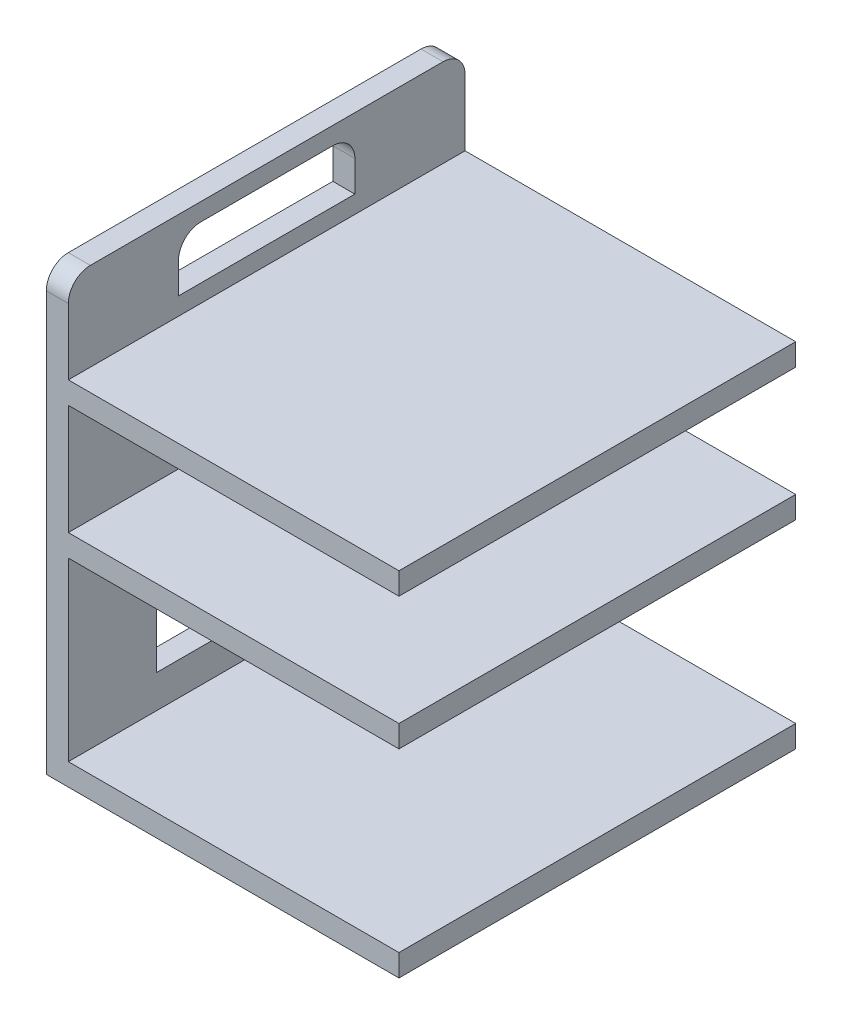
from build123d import *

# Parameters (mm, degrees)
BOSS_EXTRUDE1_DEPTH = 5
SKETCH2_W           = 90
SKETCH2_H           = 5
BOSS_EXTRUDE2_DEPTH = 75
CUT_EXTRUDE1_REACH  = 131.422
SKETCH4_W           = 40
SKETCH4_H           = 12
CUT_EXTRUDE2_REACH  = 131.422
SKETCH5_W           = 40
SKETCH5_H           = 12
CUT_EXTRUDE3_REACH  = 131.422
SKETCH7_W           = 50
SKETCH7_H           = 25
FILLET1_R           = 5
FILLET2_R           = 5


with BuildPart() as part:
    # Sketch1 → Boss-Extrude1 (new body)
    with BuildSketch(Plane(origin=(0, 0, 0), x_dir=(0, 0, -1), z_dir=(1, 0, 0))):
        Polygon((90, 45), (0, 45), (0, 25), (0, 20), (0, 16.441443772), (0, 4.747474747), (0, 0), (0, -5), (0, -10), (0, -50), (0, -55), (90, -55), (90, -10), (90, -5), (90, 16.441443772), (90, 25), align=None)
    extrude(amount=BOSS_EXTRUDE1_DEPTH)

    # Sketch2 → Boss-Extrude2 (add)
    with BuildSketch(Plane(origin=(5, 0, 0), x_dir=(0, 0, -1), z_dir=(1, 0, 0))):
        with Locations((45, 22.5)):
            Rectangle(SKETCH2_W, SKETCH2_H)
        with Locations((45, -7.5)):
            Rectangle(SKETCH2_W, SKETCH2_H)
        with Locations((45, -52.5)):
            Rectangle(SKETCH2_W, SKETCH2_H)
    extrude(amount=BOSS_EXTRUDE2_DEPTH)

    # Sketch4 → Cut-Extrude1 (cut, up to next)
    with BuildSketch(Plane(origin=(5, 0, 0), x_dir=(0, 0, -1), z_dir=(1, 0, 0)), mode=Mode.PRIVATE) as cut_extrude1_sk1:
        with Locations((45, 35)):
            Rectangle(SKETCH4_W, SKETCH4_H)
    cut_extrude1_tool1 = extrude(cut_extrude1_sk1.sketch, amount=-CUT_EXTRUDE1_REACH, mode=Mode.PRIVATE) & part.part
    add(cut_extrude1_tool1.solids().sort_by_distance((5, 35, -45))[0], mode=Mode.SUBTRACT)

    # Sketch5 → Cut-Extrude2 (cut, up to next)
    with BuildSketch(Plane(origin=(5, 0, 0), x_dir=(0, 0, -1), z_dir=(1, 0, 0)), mode=Mode.PRIVATE) as cut_extrude2_sk1:
        with Locations((45, 7.5)):
            Rectangle(SKETCH5_W, SKETCH5_H)
    cut_extrude2_tool1 = extrude(cut_extrude2_sk1.sketch, amount=-CUT_EXTRUDE2_REACH, mode=Mode.PRIVATE) & part.part
    add(cut_extrude2_tool1.solids().sort_by_distance((5, 7.5, -45))[0], mode=Mode.SUBTRACT)

    # Sketch7 → Cut-Extrude3 (cut, up to next)
    with BuildSketch(Plane(origin=(5, 0, 0), x_dir=(0, 0, -1), z_dir=(1, 0, 0)), mode=Mode.PRIVATE) as cut_extrude3_sk1:
        with Locations((45, -30)):
            Rectangle(SKETCH7_W, SKETCH7_H)
    cut_extrude3_tool1 = extrude(cut_extrude3_sk1.sketch, amount=-CUT_EXTRUDE3_REACH, mode=Mode.PRIVATE) & part.part
    add(cut_extrude3_tool1.solids().sort_by_distance((5, -30, -45))[0], mode=Mode.SUBTRACT)

    # Fillet1
    fillet1_edges = [part.edges().sort_by_distance(p)[0] for p in [
        (2.5, 41, -65),
        (2.5, 41, -25),
        (2.5, 45, -90),
        (2.5, 45, 0),
    ]]
    fillet(fillet1_edges, radius=FILLET1_R)

    # Fillet2
    fillet2_edges = [part.edges().sort_by_distance(p)[0] for p in [
        (2.5, -17.5, -20),
        (2.5, -17.5, -70),
        (2.5, 13.5, -25),
        (2.5, 13.5, -65),
    ]]
    fillet(fillet2_edges, radius=FILLET2_R)


solid = part.part
